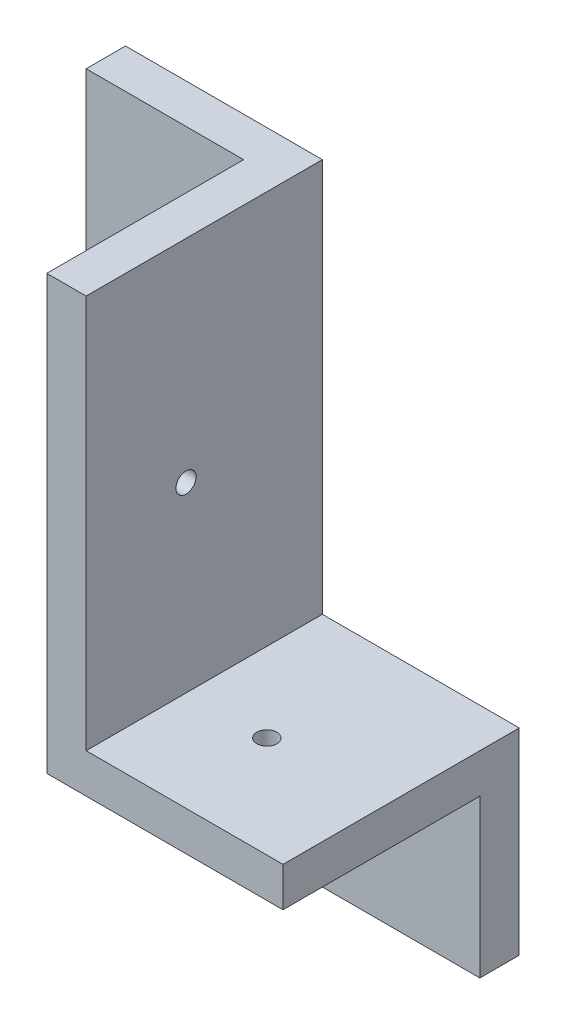
from build123d import *

# Parameters (mm, degrees)
BOSS_EXTRUDE1_DEPTH = 10
BOSS_EXTRUDE2_DEPTH = 50


with BuildPart() as part:
    # Sketch1 → Boss-Extrude1 (new body)
    with BuildSketch(Plane.XY):
        Polygon((0, 150), (50, 150), (50, 50), (100, 50), (100, 0), (0, 0), align=None)
    extrude(amount=BOSS_EXTRUDE1_DEPTH)

    # Sketch2 → Boss-Extrude2 (add)
    with BuildSketch(Plane.XY.offset(10)):
        Polygon((40, 150), (40, 40), (100, 40), (100, 50), (50, 50), (50, 150), align=None)
    extrude(amount=BOSS_EXTRUDE2_DEPTH)

    # Sketch3 → CBORE for _10 Binding Head Machine Screw (revolve, cut)
    with BuildSketch(Plane(origin=(25.416829558, 24.242970072, 10), x_dir=(0, -1, 0), z_dir=(1, 0, 0))):
        Polygon((0, 0), (0, 10), (2.5527, 10), (2.5527, 3.1242), (5.55625, 3.1242), (5.55625, 0.635), (6.19125, 0), align=None)
    revolve(axis=Axis((25.416829558, 24.242970072, 16.35), (0, 0, -1)), mode=Mode.SUBTRACT)

    # Sketch5 → CBORE for _10 Binding Head Machine S 2 (revolve, cut)
    with BuildSketch(Plane(origin=(21.022152891, 97.747632293, 10), x_dir=(0, -1, 0), z_dir=(1, 0, 0))):
        Polygon((0, 0), (0, 10), (2.5527, 10), (2.5527, 3.1242), (5.55625, 3.1242), (5.55625, 0.635), (6.19125, 0), align=None)
    revolve(axis=Axis((21.022152891, 97.747632293, 16.35), (0, 0, -1)), mode=Mode.SUBTRACT)

    # Sketch7 → CBORE for _10 Binding Head Machine S 3 (revolve, cut)
    with BuildSketch(Plane(origin=(40, 96.298739313, 34.636470037), x_dir=(0, 0, 1), z_dir=(0, 1, 0))):
        Polygon((0, 0), (0, 60.00005), (2.5527, 60.00005), (2.5527, 3.1242), (5.55625, 3.1242), (5.55625, 0.635), (6.19125, 0), align=None)
    revolve(axis=Axis((33.65, 96.298739313, 34.636470037), (1, 0, 0)), mode=Mode.SUBTRACT)

    # Sketch9 → CBORE for _10 Binding Head Machine S 4 (revolve, cut)
    with BuildSketch(Plane(origin=(70.152801721, 40, 34.254490224), x_dir=(0, 0, -1), z_dir=(1, 0, 0))):
        Polygon((0, 0), (0, 110.00005), (2.5527, 110.00005), (2.5527, 3.1242), (5.55625, 3.1242), (5.55625, 0.635), (6.19125, 0), align=None)
    revolve(axis=Axis((70.152801721, 33.65, 34.254490224), (0, 1, 0)), mode=Mode.SUBTRACT)


solid = part.part
